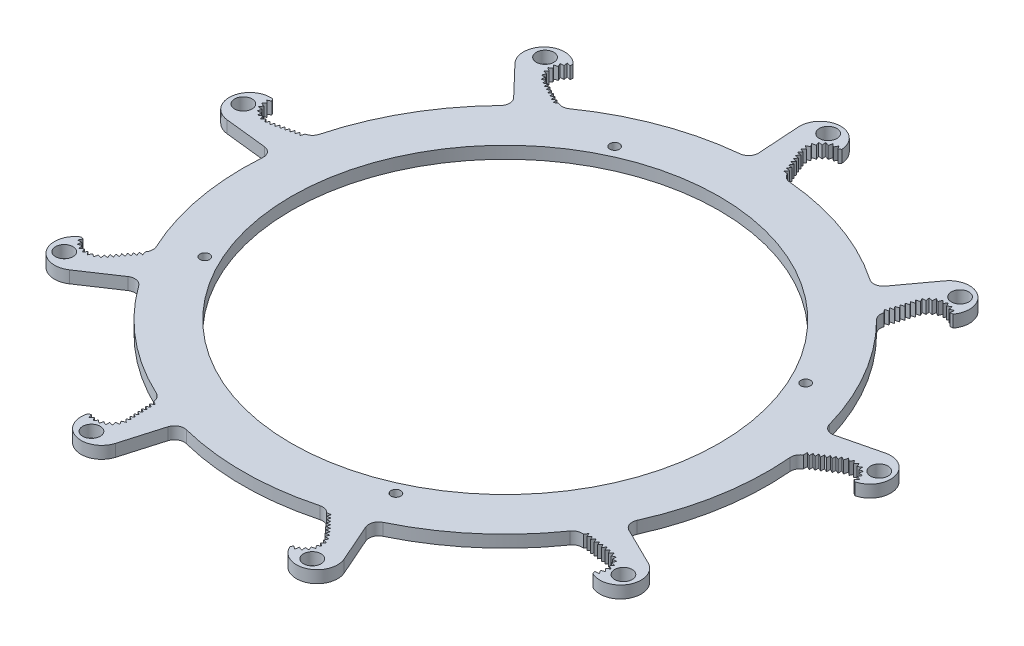
from build123d import *

# Parameters (mm, degrees)
SKETCH1_R           = 68.58
SKETCH1_R_2         = 55.88
BOSS_EXTRUDE1_DEPTH = 3.175
BOSS_EXTRUDE2_START = -3.175
BOSS_EXTRUDE2_DEPTH = 3.175
CIRPATTERN1_COUNT   = 9
SKETCH4_R           = 1.27
CUT_EXTRUDE1_DEPTH  = 124.088082607
CIRPATTERN14_COUNT  = 4
CUT_EXTRUDE2_DEPTH  = 124.088082607
CRVPATTERN1_DEPTH   = 3.175
CIRPATTERN15_COUNT  = 9
SKETCH3_R           = 2.286
CUT_EXTRUDE3_DEPTH  = 124.088082607
CIRPATTERN16_COUNT  = 9


# Read off the part's stored shape, not the designer's step: CrvPattern1
with BuildPart() as part:
    # Sketch1 → Boss-Extrude1 (new body)
    with BuildSketch(Plane(origin=(0, 0, 0), x_dir=(1, 0, 0), z_dir=(0, 1, 0))):
        with Locations(Location((0, 0, 0), (0, 0, 270))):
            Circle(SKETCH1_R)
        with Locations(Location((0, 0, 0), (0, 0, 270))):
            Circle(SKETCH1_R_2, mode=Mode.SUBTRACT)
    extrude(amount=BOSS_EXTRUDE1_DEPTH)

    # Sketch2 → Boss-Extrude2 (add)
    with BuildSketch(Plane(origin=(0, 3.175, 0), x_dir=(1, 0, 0), z_dir=(0, 1, 0)).offset(BOSS_EXTRUDE2_START)):
        with BuildLine():
            Line((-4.648503105, 70.922452149), (-5.367925957, 81.898723786))
            ThreePointArc((-5.367925957, 81.898723786), (0, 87.63), (5.367925957, 81.898723786))
            ThreePointArc((5.367925957, 81.898723786), (1.585103244, 80.66312392), (0.966324082, 76.732021396))
            Line((0.966324082, 76.732021396), (3.81, 69.87951531))
            ThreePointArc((3.81, 69.87951531), (4.65537594, 68.803759817), (5.936157335, 68.322605601))
            ThreePointArc((5.936157335, 68.322605601), (-0.497376724, 68.578196363), (-6.926526743, 68.22931648))
            ThreePointArc((-6.926526743, 68.22931648), (-5.243785443, 69.115963701), (-4.648503105, 70.922452149))
        make_face()
    boss_extrude2 = extrude(amount=BOSS_EXTRUDE2_DEPTH)

    # CirPattern1: Boss-Extrude2 ×9 about axis
    cirpattern1_axis = Axis((0, 0, 0), (0, 1, 0))
    for i in range(1, CIRPATTERN1_COUNT):
        add(boss_extrude2.rotate(cirpattern1_axis, i * 360 / CIRPATTERN1_COUNT))

    # Sketch4 → Cut-Extrude1 (cut, through all)
    with BuildSketch(Plane(origin=(0, 3.175, 0), x_dir=(1, 0, 0), z_dir=(0, 1, 0))):
        with Locations(Location((53.522006363, 24.957721447, 0), (0, 0, 270))):
            Circle(SKETCH4_R)
    cut_extrude1 = extrude(amount=-CUT_EXTRUDE1_DEPTH, mode=Mode.SUBTRACT)

    # CirPattern14: Cut-Extrude1 ×4 about axis
    cirpattern14_axis = Axis((0, 0, 0), (0, 1, 0))
    for i in range(1, CIRPATTERN14_COUNT):
        add(cut_extrude1.rotate(cirpattern14_axis, i * 360 / CIRPATTERN14_COUNT), mode=Mode.SUBTRACT)

    # Sketch6 → Cut-Extrude2 (cut, through all)
    with BuildSketch(Plane(origin=(0, 3.175, 0), x_dir=(1, 0, 0), z_dir=(0, 1, 0))):
        Polygon((3.47094583, 71.027887706), (3.957724412, 69.854880199), (2.775929115, 70.051961086), align=None)
    cut_extrude2 = extrude(amount=-CUT_EXTRUDE2_DEPTH, mode=Mode.SUBTRACT)

    # CrvPattern1 outline → CrvPattern1 (cut)
    with BuildSketch(Plane(origin=(0, 0, 0), x_dir=(1, 0, 0), z_dir=(0, 1, 0))):
        with BuildLine():
            Line((2.954390649, 71.893612642), (2.35875647, 71.057236713))
            Line((2.35875647, 71.057236713), (3.371563294, 70.888337016))
            Line((3.371563294, 70.888337016), (3.38406874, 70.905896878))
            Line((3.38406874, 70.905896878), (0.966324082, 76.732021396))
            ThreePointArc((0.966324082, 76.732021396), (1.585103244, 80.66312392), (5.367925957, 81.898723786))
            ThreePointArc((5.367925957, 81.898723786), (5.37940733, 82.230759048), (5.370370135, 82.562869823))
            Line((5.370370135, 82.562869823), (4.835817307, 82.035720051))
            Line((4.835817307, 82.035720051), (4.241589962, 82.88503055))
            Line((4.241589962, 82.88503055), (3.738556552, 81.978723842))
            Line((3.738556552, 81.978723842), (2.929076067, 82.62616172))
            Line((2.929076067, 82.62616172), (2.701825603, 81.614830079))
            Line((2.701825603, 81.614830079), (1.74270305, 82.007918354))
            Line((1.74270305, 82.007918354), (1.809654933, 80.973533557))
            Line((1.809654933, 80.973533557), (0.778630371, 81.080411122))
            Line((0.778630371, 81.080411122), (1.13435793, 80.106813481))
            Line((1.13435793, 80.106813481), (0.114999311, 79.918817556))
            Line((0.114999311, 79.918817556), (0.73066965, 79.084920383))
            Line((0.73066965, 79.084920383), (-0.194400635, 78.617288659))
            Line((-0.194400635, 78.617288659), (0.631310365, 77.990682079))
            Line((0.631310365, 77.990682079), (-0.124491578, 77.281317657))
            Line((-0.124491578, 77.281317657), (0.859335479, 76.907083655))
            Line((0.859335479, 76.907083655), (0.272893244, 76.083614844))
            Line((0.272893244, 76.083614844), (1.285700068, 75.914715147))
            Line((1.285700068, 75.914715147), (0.690065889, 75.078339218))
            Line((0.690065889, 75.078339218), (1.702872713, 74.909439521))
            Line((1.702872713, 74.909439521), (1.107238535, 74.073063591))
            Line((1.107238535, 74.073063591), (2.120045358, 73.904163894))
            Line((2.120045358, 73.904163894), (1.52441118, 73.067787965))
            Line((1.52441118, 73.067787965), (2.537218003, 72.898888268))
            Line((2.537218003, 72.898888268), (1.941583825, 72.062512339))
            Line((1.941583825, 72.062512339), (2.954390649, 71.893612642))
        make_face()
    crvpattern1 = extrude(amount=CRVPATTERN1_DEPTH, mode=Mode.SUBTRACT)

    # CirPattern15: Cut-Extrude2, CrvPattern1 ×9 about axis
    cirpattern15_axis = Axis((0, 0, 0), (0, 1, 0))
    add([cut_extrude2.rotate(cirpattern15_axis, i * 360 / CIRPATTERN15_COUNT) for i in range(1, CIRPATTERN15_COUNT)], mode=Mode.SUBTRACT)
    add([crvpattern1.rotate(cirpattern15_axis, i * 360 / CIRPATTERN15_COUNT) for i in range(1, CIRPATTERN15_COUNT)], mode=Mode.SUBTRACT)

    # Sketch3 → Cut-Extrude3 (cut, through all)
    with BuildSketch(Plane(origin=(0, 3.175, 0), x_dir=(1, 0, 0), z_dir=(0, 1, 0))):
        with Locations(Location((0, 84.328, 0), (0, 0, 270))):
            Circle(SKETCH3_R)
    cut_extrude3 = extrude(amount=-CUT_EXTRUDE3_DEPTH, mode=Mode.SUBTRACT)

    # CirPattern16: Cut-Extrude3 ×9 about axis
    cirpattern16_axis = Axis((0, 0, 0), (0, 1, 0))
    for i in range(1, CIRPATTERN16_COUNT):
        add(cut_extrude3.rotate(cirpattern16_axis, i * 360 / CIRPATTERN16_COUNT), mode=Mode.SUBTRACT)


solid = part.part
